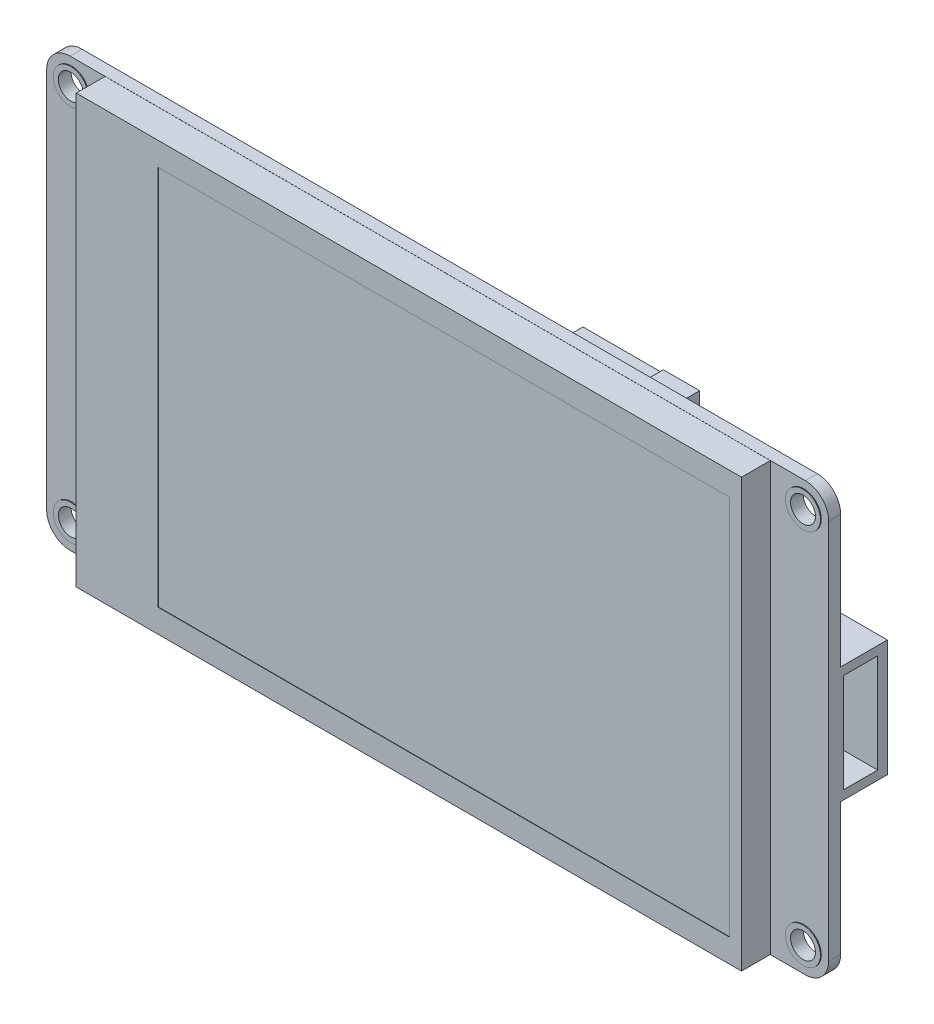
from build123d import *
from build123d.topology import SkipClean

# Parameters (mm, degrees)
BOSS_EXTRUDE1_DEPTH        = 1.54
F_3_2_3_2_DIAMETER_HOLE1_D = 3.2
SKETCH4_R                  = 2.25
SKETCH4_R_2                = 1.6
BOSS_EXTRUDE2_DEPTH        = 0.1
SKETCH5_W                  = 85.5
SKETCH5_H                  = 54.969341598
BOSS_EXTRUDE3_DEPTH        = 3.7
SKETCH6_W                  = 73.44
SKETCH6_H                  = 48.96
CUT_EXTRUDE1_DEPTH         = 0.05
SKETCH7_W                  = 6
SKETCH7_H                  = 15
BOSS_EXTRUDE4_DEPTH        = 7.1
SKETCH8_W                  = 4.418406876
SKETCH8_H                  = 12.715571876
CUT_EXTRUDE2_DEPTH         = 6
BOSS_EXTRUDE5_DEPTH        = 1.88


with BuildPart() as part:
    # Sketch1 → Boss-Extrude1 (new body)
    with BuildSketch(Plane.XY):
        with BuildLine():
            Line((-47.25, 27.5), (47.25, 27.5))
            ThreePointArc((47.25, 27.5), (49.371320344, 26.621320344), (50.25, 24.5))
            Line((50.25, 24.5), (50.25, -24.5))
            ThreePointArc((50.25, -24.5), (49.371320344, -26.621320344), (47.25, -27.5))
            Line((47.25, -27.5), (-47.25, -27.5))
            ThreePointArc((-47.25, -27.5), (-49.371320344, -26.621320344), (-50.25, -24.5))
            Line((-50.25, -24.5), (-50.25, 24.5))
            ThreePointArc((-50.25, 24.5), (-49.371320344, 26.621320344), (-47.25, 27.5))
        make_face()
    extrude(amount=BOSS_EXTRUDE1_DEPTH)

    # Ø3.2 (3.2) Diameter Hole1 (through all)
    with Locations(Plane.XY.offset(1.54)):
        with Locations((-47.05, 24.25), (47.05, 24.25), (47.05, -24.25), (-47.05, -24.25)):
            Hole(F_3_2_3_2_DIAMETER_HOLE1_D / 2)

    # Sketch4 → Boss-Extrude2 (add)
    # profile 1 of 4: a face of its own
    with SkipClean():  # the faces are left unmerged after this step: merging them gives an invalid solid
        with BuildSketch(Plane.XY.offset(1.54)):
            with Locations((-47.05, 24.25)):
                Circle(SKETCH4_R)
            with Locations((-47.05, 24.25)):
                Circle(SKETCH4_R_2, mode=Mode.SUBTRACT)
        # profile 2 of 4: a face of its own
        with BuildSketch(Plane.XY.offset(1.54)):
            with Locations((-47.05, -24.25)):
                Circle(SKETCH4_R)
            with Locations((-47.05, -24.25)):
                Circle(SKETCH4_R_2, mode=Mode.SUBTRACT)
        # profile 3 of 4: a face of its own
        with BuildSketch(Plane.XY.offset(1.54)):
            with Locations((47.05, -24.25)):
                Circle(SKETCH4_R)
            with Locations((47.05, -24.25)):
                Circle(SKETCH4_R_2, mode=Mode.SUBTRACT)
        # profile 4 of 4: a face of its own
        with BuildSketch(Plane.XY.offset(1.54)):
            with Locations((47.05, 24.25)):
                Circle(SKETCH4_R)
            with Locations((47.05, 24.25)):
                Circle(SKETCH4_R_2, mode=Mode.SUBTRACT)
        extrude(amount=BOSS_EXTRUDE2_DEPTH)
    add(part.part.scale(1), mode=Mode.REPLACE)  # the faces are merged on a copy

    # Sketch5 → Boss-Extrude3 (add)
    with BuildSketch(Plane.XY.offset(1.54)):
        Rectangle(SKETCH5_W, SKETCH5_H)
    extrude(amount=BOSS_EXTRUDE3_DEPTH)

    # Sketch6 → Cut-Extrude1 (cut)
    with BuildSketch(Plane.XY.offset(5.24)):
        with Locations((4.48, 0)):
            Rectangle(SKETCH6_W, SKETCH6_H)
    extrude(amount=-CUT_EXTRUDE1_DEPTH, mode=Mode.SUBTRACT)

    # Sketch7 → Boss-Extrude4 (add)
    with BuildSketch(Plane(origin=(50.25, 0, 0), x_dir=(0, 0, -1), z_dir=(1, 0, 0))):
        with Locations((3, 0)):
            Rectangle(SKETCH7_W, SKETCH7_H)
    extrude(amount=-BOSS_EXTRUDE4_DEPTH)

    # Sketch8 → Cut-Extrude2 (cut)
    with BuildSketch(Plane(origin=(50.25, 0, 0), x_dir=(0, 0, -1), z_dir=(1, 0, 0))):
        with Locations((2.548027157, 0)):
            Rectangle(SKETCH8_W, SKETCH8_H)
    extrude(amount=-CUT_EXTRUDE2_DEPTH, mode=Mode.SUBTRACT)

    # Sketch9 → Boss-Extrude5 (add)
    with BuildSketch(Plane(origin=(0, 0, 0), x_dir=(-1, 0, 0), z_dir=(0, 0, -1))):
        with BuildLine():
            Line((-30.25, 12.3), (-15.25, 12.3))
            Line((-15.25, 12.3), (-15.25, 26.9))
            Line((-15.25, 26.9), (-25.232632272, 26.9))
            ThreePointArc((-25.232632272, 26.9), (-25.480119645, 27.002512627), (-25.582632272, 27.25))
            Line((-25.582632272, 27.25), (-25.582632272, 27.3))
            Line((-25.582632272, 27.3), (-30.25, 27.3))
            Line((-30.25, 27.3), (-30.25, 12.3))
        make_face()
    extrude(amount=BOSS_EXTRUDE5_DEPTH)


solid = part.part
